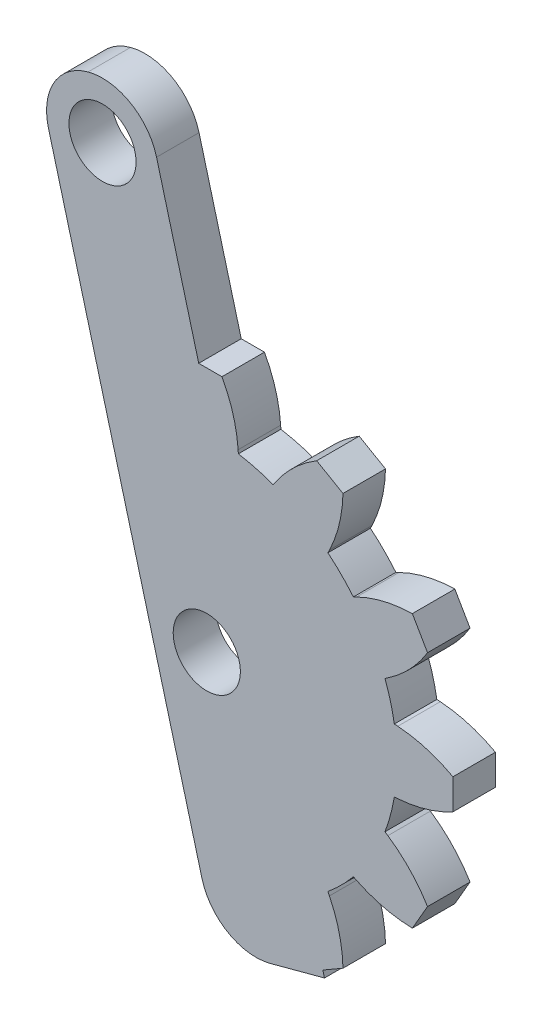
from build123d import *

# Parameters (mm, degrees)
SKETCH1_R           = 8.5
BOSS_EXTRUDE1_DEPTH = 1.9
BOSS_EXTRUDE2_DEPTH = 1.9
CIRPATTERN2_COUNT   = 12
FILLET5_R           = 6
FILLET6_R           = 6
BOSS_EXTRUDE5_DEPTH = 1.9
SKETCH15_R          = 5
BOSS_EXTRUDE6_DEPTH = 1.9
SKETCH14_R          = 1.5
CUT_EXTRUDE7_DEPTH  = 24.297043988
CUT_EXTRUDE8_DEPTH  = 24.297043988
SKETCH17_R          = 1.5
CUT_EXTRUDE9_DEPTH  = 24.297043988
FILLET7_R           = 2.5


# Some blends are built 0.0001 mm under size
with BuildPart() as part:
    # Sketch1 → Boss-Extrude1 (new body)
    with BuildSketch(Plane.XY):
        with Locations(Location((0, 0, 0), (0, 0, 180))):
            Circle(SKETCH1_R)
    extrude(amount=BOSS_EXTRUDE1_DEPTH)

    # Sketch3 → Boss-Extrude2 (add)
    with BuildSketch(Plane.XY.offset(1.9)):
        Polygon((-1.305261922, 9.914448614), (-1.509060022, 7), (1.509060022, 7), (1.305261922, 9.914448614), (0.678518537, 11), (-0.678518537, 11), align=None)
    boss_extrude2 = extrude(amount=-BOSS_EXTRUDE2_DEPTH)

    # CirPattern2: Boss-Extrude2 ×12 about axis
    cirpattern2_axis = Axis((0, 0, 0), (0, 0, 1))
    for i in range(1, CIRPATTERN2_COUNT):
        add(boss_extrude2.rotate(cirpattern2_axis, i * 360 / CIRPATTERN2_COUNT))

    # Fillet5
    # the kernel refuses this fillet: 6 mm, written as the material it takes off along each edge
    with BuildSketch(Plane(origin=(9.238795325, 3.826834324, 5.354382408), x_dir=(0.49999999999981276, 0.8660254037845467, 0), z_dir=(0, 0, -1)), Plane(origin=(1.305261922, 9.914448614, 5.354382408), x_dir=(-0.5000000000001841, 0.8660254037843323, 0), z_dir=(0, 0, -1)), Plane(origin=(-7.933533403, 6.08761429, 5.354382408), x_dir=(-1, 0, 0), z_dir=(0, 0, -1)), Plane(origin=(-9.914448614, 1.305261922, 5.354382408), x_dir=(-0.8660254037843321, -0.5000000000001844, 0), z_dir=(0, 0, -1)), Plane(origin=(-9.238795325, -3.826834324, 5.354382408), x_dir=(-0.49999999999981826, -0.8660254037845436, 0), z_dir=(0, 0, -1)), Plane(origin=(-6.08761429, -7.933533403, 5.354382408), x_dir=(0, -1, 0), z_dir=(0, 0, -1)), Plane(origin=(3.826834324, -9.238795325, 5.354382408), x_dir=(0.8660254037845474, -0.49999999999981154, 0), z_dir=(0, 0, -1)), Plane(origin=(7.933533403, -6.08761429, 5.354382408), x_dir=(1, 0, 0), z_dir=(0, 0, -1)), Plane(origin=(9.914448614, -1.305261922, 5.354382408), x_dir=(0.866025403784333, 0.500000000000183, 0), z_dir=(0, 0, -1))) as fillet5_piece_1:
        with BuildLine():
            CenterArc((1.388315544, -5.998484909), FILLET5_R, 91.287628333, 24.712371667)
            Line((-1.241911337, -0.605720631), (-1.294515874, -0.497865346))
            Line((-1.294515874, -0.497865346), (-0.052604538, 0.107855286))
            Line((-0.052604538, 0.107855286), (0, 0.12))
            ThreePointArc((0, 0.12), (0.626743385, 0.12), (1.250790195, 0.119969698))
            Line((1.250790195, 0.119969698), (1.25348677, 0))
        make_face()
    extrude(amount=8.808764816, mode=Mode.SUBTRACT)
    with BuildSketch(Plane(origin=(6.08761429, 7.933533403, 5.354382408), x_dir=(-0.4383711467890806, -0.8987940462991654, 0), z_dir=(0, 0, -1)), Plane(origin=(-3.826834324, 9.238795325, 5.354382408), x_dir=(0.5591929034707432, -0.8290375725550441, 0), z_dir=(0, 0, -1)), Plane(origin=(-1.305261922, -9.914448614, 5.354382408), x_dir=(-0.06975647374412203, 0.9975640502598244, 0), z_dir=(0, 0, -1))) as fillet5_piece_2:
        with BuildLine():
            CenterArc((1.381752963, 6), FILLET5_R, 245.287628333, 24.712371667)
            Line((-1.126626446, 0.549492433), (-1.176794034, 0.440482282))
            ThreePointArc((-1.176794034, 0.440482282), (-0.615917761, 0.166890931), (-0.052604538, -0.107855286))
            Line((-0.052604538, -0.107855286), (0, -0.12))
            Line((0, -0.12), (1.381752963, -0.12))
            Line((1.381752963, -0.12), (1.381752963, 0))
        make_face()
    extrude(amount=8.808764816, mode=Mode.SUBTRACT)

    # Fillet6
    # the kernel refuses this fillet: 6 mm, written as the material it takes off along each edge
    with BuildSketch(Plane(origin=(7.933533403, 6.08761429, 5.354382408), x_dir=(-0.8987940462991681, -0.4383711467890751, 0), z_dir=(0, 0, -1)), Plane(origin=(3.826834324, 9.238795325, 5.354382408), x_dir=(-0.5591929034707512, -0.8290375725550386, 0), z_dir=(0, 0, -1)), Plane(origin=(-1.305261922, 9.914448614, 5.354382408), x_dir=(-0.06975647374412959, -0.9975640502598239, 0), z_dir=(0, 0, -1)), Plane(origin=(-6.08761429, 7.933533403, 5.354382408), x_dir=(0.43837114678907496, -0.8987940462991681, 0), z_dir=(0, 0, -1)), Plane(origin=(-9.238795325, 3.826834324, 5.354382408), x_dir=(0.8290375725550395, -0.5591929034707501, 0), z_dir=(0, 0, -1)), Plane(origin=(-9.914448614, -1.305261922, 5.354382408), x_dir=(0.9975640502598241, -0.0697564737441288, 0), z_dir=(0, 0, -1)), Plane(origin=(-7.933533403, -6.08761429, 5.354382408), x_dir=(0.8987940462991686, 0.4383711467890744, 0), z_dir=(0, 0, -1)), Plane(origin=(-3.826834324, -9.238795325, 5.354382408), x_dir=(0.5591929034707488, 0.8290375725550403, 0), z_dir=(0, 0, -1)), Plane(origin=(1.305261922, -9.914448614, 5.354382408), x_dir=(0.06975647374412966, 0.9975640502598239, 0), z_dir=(0, 0, -1)), Plane(origin=(6.08761429, -7.933533403, 5.354382408), x_dir=(-0.4383711467890749, 0.8987940462991683, 0), z_dir=(0, 0, -1)), Plane(origin=(9.238795325, -3.826834324, 5.354382408), x_dir=(-0.8290375725550393, 0.5591929034707505, 0), z_dir=(0, 0, -1)), Plane(origin=(9.914448614, 1.305261922, 5.354382408), x_dir=(-0.9975640502598239, 0.06975647374412894, 0), z_dir=(0, 0, -1))) as fillet6_piece_1:
        with BuildLine():
            CenterArc((1.381752963, -6), FILLET6_R, 90, 24.712371667)
            Line((-1.126626446, -0.549492433), (-1.176794034, -0.440482282))
            ThreePointArc((-1.176794034, -0.440482282), (-0.615917761, -0.166890931), (-0.052604538, 0.107855286))
            Line((-0.052604538, 0.107855286), (0, 0.12))
            Line((0, 0.12), (1.381752963, 0.12))
            Line((1.381752963, 0.12), (1.381752963, 0))
        make_face()
    extrude(amount=8.808764816, mode=Mode.SUBTRACT)

    # Sketch12 → Boss-Extrude5 (add)
    with BuildSketch(Plane(origin=(0, 0, 0), x_dir=(-1, 0, 0), z_dir=(0, 0, -1))):
        Polygon((1.535905814, 15.391336798), (-5.261824062, -9.978136476), (-0.43219493, -11.272231702), (7.72060499, 19.154431826), (2.890975859, 20.448527052), align=None)
    extrude(amount=-BOSS_EXTRUDE5_DEPTH)

    # Sketch15 → Boss-Extrude6 (add)
    with BuildSketch(Plane(origin=(0, 0, 0), x_dir=(-1, 0, 0), z_dir=(0, 0, -1))):
        Circle(SKETCH15_R)
    extrude(amount=-BOSS_EXTRUDE6_DEPTH)

    # Sketch14 → Cut-Extrude7 (cut, through all)
    with BuildSketch(Plane(origin=(0, 0, 0), x_dir=(-1, 0, 0), z_dir=(0, 0, -1))):
        Circle(SKETCH14_R)
    extrude(amount=-CUT_EXTRUDE7_DEPTH, mode=Mode.SUBTRACT)

    # Sketch16 → Cut-Extrude8 (cut, through all)
    with BuildSketch(Plane.XY.offset(1.9)):
        Polygon((-5.659024027, 11.460506927), (0.43219493, -11.272231702), (-8.69145043, -13.716905108), (-14.782669387, 9.015833521), align=None)
    extrude(amount=-CUT_EXTRUDE8_DEPTH, mode=Mode.SUBTRACT)

    # Sketch17 → Cut-Extrude9 (cut, through all)
    with BuildSketch(Plane.XY.offset(1.9)):
        with Locations((-4.658742812, 17.386664873)):
            Circle(SKETCH17_R)
    extrude(amount=-CUT_EXTRUDE9_DEPTH, mode=Mode.SUBTRACT)

    # Fillet7
    fillet7_edges = [part.edges().sort_by_distance(p)[0] for p in [
        (-7.72060499, 19.154431826, 0.95),
        (-2.890975859, 20.448527052, 0.95),
        (0.43219493, -11.272231702, 0.95),
    ]]
    fillet(fillet7_edges, radius=FILLET7_R - 0.0001)  # a hair under: the kernel refuses the full size


solid = part.part
